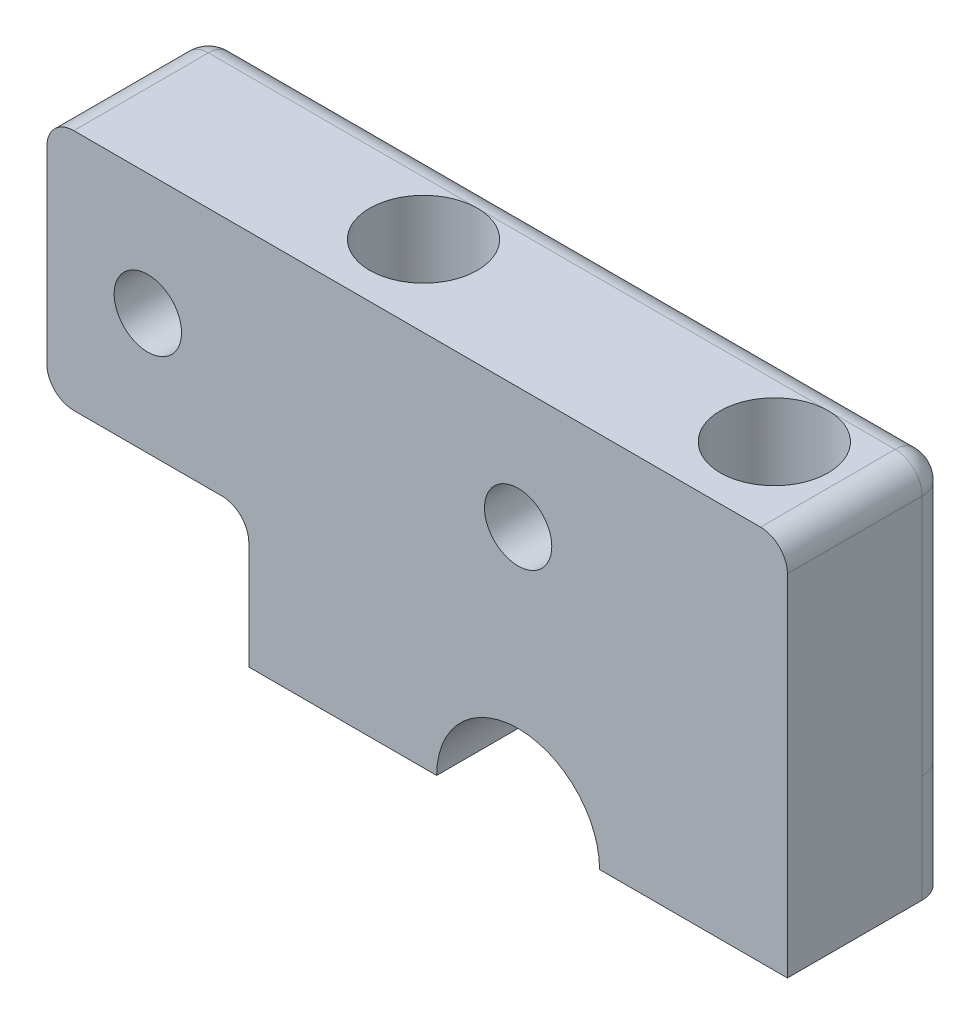
from build123d import *

# Parameters (mm, degrees)
ESQUISSE1_W                  = 40
ESQUISSE1_H                  = 18
BOSS_EXTRU_1_DEPTH           = 12
ESQUISSE2_W                  = 40
ESQUISSE2_H                  = 12
BOSS_EXTRU_2_DEPTH           = 10
ENL_V_MAT_EXTRU_1_DEPTH      = 12
ESQUISSE4_R                  = 2.5
ENL_V_MAT_EXTRU_2_DEPTH      = 28
ESQUISSE5_R                  = 2.5
ENL_V_MAT_EXTRU_3_DEPTH      = 12
ESQUISSE6_R                  = 4
ENL_V_MAT_EXTRU_5_DEPTH      = 12
ESQUISSE7_W                  = 12
ESQUISSE7_H                  = 18
BOSS_EXTRU_3_DEPTH           = 15
ESQUISSE8_W                  = 12
ESQUISSE8_H                  = 18
BOSS_EXTRU_4_DEPTH           = 15
ESQUISSE9_R                  = 2.5
ENL_V_MAT_EXTRU_6_DEPTH      = 12
CONG_1_R                     = 2
ENL_V_MAT_EXTRU_7_DEPTH      = 10
ENL_V_MAT_EXTRU_7_DEPTH_BACK = 27
ESQUISSE11_W                 = 15
ESQUISSE11_H                 = 16.6984892
CONG_2_R                     = 2


# Some blends are built 0.0001 mm under size
with BuildPart() as part:
    # Esquisse1 → Boss.-Extru.1 (new body)
    with BuildSketch(Plane.XY):
        with Locations((3.185612757, 0.725848564)):
            Rectangle(ESQUISSE1_W, ESQUISSE1_H)
    extrude(amount=BOSS_EXTRU_1_DEPTH)

    # Esquisse2 → Boss.-Extru.2 (add)
    with BuildSketch(Plane.XZ.offset(8.274151436)):
        with Locations((3.185612757, 6)):
            Rectangle(ESQUISSE2_W, ESQUISSE2_H)
    extrude(amount=BOSS_EXTRU_2_DEPTH)

    # Esquisse3 → Enlèv. mat.-Extru.1 (cut)
    with BuildSketch(Plane.XY.offset(12)):
        with BuildLine():
            Line((-2.864387243, -18.274151436), (9.235612757, -18.274151436))
            ThreePointArc((9.235612757, -18.274151436), (3.185612757, -12.224151436), (-2.864387243, -18.274151436))
        make_face()
    extrude(amount=-ENL_V_MAT_EXTRU_1_DEPTH, mode=Mode.SUBTRACT)

    # Esquisse4 → Enlèv. mat.-Extru.2 (cut)
    with BuildSketch(Plane.XZ.offset(18.274151436)):
        with Locations(Location((-9.839387243, 6, 0), (0, 0, 270))):
            Circle(ESQUISSE4_R)
        with Locations(Location((16.210612757, 6, 0), (0, 0, 270))):
            Circle(ESQUISSE4_R)
    extrude(amount=-ENL_V_MAT_EXTRU_2_DEPTH, mode=Mode.SUBTRACT)

    # Esquisse5 → Enlèv. mat.-Extru.3 (cut)
    with BuildSketch(Plane.XY.offset(12)):
        with Locations((3.185612757, 0.725848564)):
            Circle(ESQUISSE5_R)
    extrude(amount=-ENL_V_MAT_EXTRU_3_DEPTH, mode=Mode.SUBTRACT)

    # Esquisse6 → Enlèv. mat.-Extru.5 (cut)
    with BuildSketch(Plane(origin=(0, 9.725848564, 0), x_dir=(1, 0, 0), z_dir=(0, 1, 0))):
        with Locations(Location((16.210612757, -6, 0), (0, 0, 270))):
            Circle(ESQUISSE6_R)
        with Locations(Location((-9.839387243, -6, 0), (0, 0, 270))):
            Circle(ESQUISSE6_R)
    extrude(amount=-ENL_V_MAT_EXTRU_5_DEPTH, mode=Mode.SUBTRACT)

    # Esquisse7 → Boss.-Extru.3 (add)
    with BuildSketch(Plane.ZY.offset(16.814387243)):
        with Locations((6, 0.725848564)):
            Rectangle(ESQUISSE7_W, ESQUISSE7_H)
    extrude(amount=BOSS_EXTRU_3_DEPTH)

    # Esquisse8 → Boss.-Extru.4 (add)
    with BuildSketch(Plane(origin=(23.185612757, 0, 0), x_dir=(0, 0, -1), z_dir=(1, 0, 0))):
        with Locations((-6, 0.725848564)):
            Rectangle(ESQUISSE8_W, ESQUISSE8_H)
    extrude(amount=BOSS_EXTRU_4_DEPTH)

    # Esquisse9 → Enlèv. mat.-Extru.6 (cut)
    with BuildSketch(Plane.XY.offset(12)):
        with Locations((-24.314387243, 0.725848564)):
            Circle(ESQUISSE9_R)
        with Locations((30.685612757, 0.725848564)):
            Circle(ESQUISSE9_R)
    extrude(amount=-ENL_V_MAT_EXTRU_6_DEPTH, mode=Mode.SUBTRACT)

    # Congé1
    cong_1_edges = [part.edges().sort_by_distance(p)[0] for p in [
        (3.185612757, 9.725848564, 0),
        (23.185612757, -13.274151436, 0),
        (-16.814387243, -13.274151436, 0),
        (-16.814387243, -8.274151436, 6),
        (-24.314387243, -8.274151436, 0),
        (-31.814387243, 0.725848564, 0),
        (-31.814387243, -8.274151436, 6),
        (-31.814387243, 9.725848564, 6),
        (30.685612757, -8.274151436, 0),
        (23.185612757, -8.274151436, 6),
        (38.185612757, 0.725848564, 0),
        (38.185612757, 9.725848564, 6),
        (38.185612757, -8.274151436, 6),
    ]]
    fillet(cong_1_edges, radius=CONG_1_R - 0.0001)  # a hair under: the kernel refuses the full size

    # Esquisse11 → Enlèv. mat.-Extru.7 (cut, two sides: drawn at the far end of the back side and taken through both)
    with BuildSketch(Plane.XZ.offset(8.274151436).offset(-ENL_V_MAT_EXTRU_7_DEPTH_BACK)):
        with Locations((30.685612757, 5.475380595)):
            Rectangle(ESQUISSE11_W, ESQUISSE11_H)
    extrude(amount=ENL_V_MAT_EXTRU_7_DEPTH + ENL_V_MAT_EXTRU_7_DEPTH_BACK, mode=Mode.SUBTRACT)

    # Congé2
    # the kernel refuses this fillet: 2 mm, written as the material it takes off along each edge
    with BuildSketch(Plane(origin=(23.185612757, 9.725848564, 1.9999), x_dir=(-0.999999998749875, 5.00025000614922e-05, 0), z_dir=(0, 0, 1))) as cong_2_piece_1:
        with BuildLine():
            CenterArc((1.999799997, 1.999999997), CONG_2_R, 180.002864932, 90)
            Line((-0.0002, 1.999899992), (-0.0402, 1.999897992))
            ThreePointArc((-0.0402, 1.999897992), (-0.04005, 0.999947999), (-0.04, -2e-06))
            Line((-0.04, -2e-06), (2e-06, -0.04))
            ThreePointArc((2e-06, -0.04), (0.999951999, -0.03995), (1.999902003, -0.04))
            Line((1.999902003, -0.04), (1.999900003, 0))
        make_face()
    extrude(amount=14.999850006, mode=Mode.SUBTRACT)
    with BuildSketch(Plane(origin=(23.185612757, 7.725948564, 1.9999), x_dir=(0, 1, 0), z_dir=(0, 0, 1))) as cong_2_piece_2:
        with BuildLine():
            CenterArc((0, 1.9999), CONG_2_R, 270, 90)
            Line((2, 1.9999), (2.04, 1.9999))
            ThreePointArc((2.04, 1.9999), (2.0399, 0.99995), (2.0399, 0))
            Line((2.0399, 0), (1.9999, -0.04))
            ThreePointArc((1.9999, -0.04), (0.99995, -0.04), (0, -0.0401))
            Line((0, -0.0401), (0, -0.0001))
        make_face()
    revolve(axis=Axis((23.185612757, 7.725948564, 1.9999), (-1, 0, 0)), revolution_arc=90, mode=Mode.SUBTRACT)
    with BuildSketch(Plane(origin=(23.185612757, -11.809873032, 0), x_dir=(-0.999999998749875, 0, -5.000250006249136e-05), z_dir=(0, 1, 0))) as cong_2_piece_3:
        with BuildLine():
            CenterArc((1.999799998, 1.999999997), CONG_2_R, 180.002864932, 90)
            Line((-0.0002, 1.999899992), (-0.0402, 1.999897992))
            ThreePointArc((-0.0402, 1.999897992), (-0.04005, 0.999947999), (-0.04, -2e-06))
            Line((-0.04, -2e-06), (2e-06, -0.04))
            ThreePointArc((2e-06, -0.04), (0.999951999, -0.03995), (1.999902003, -0.04))
            Line((1.999902003, -0.04), (1.999900003, 0))
        make_face()
    extrude(amount=19.535821596, mode=Mode.SUBTRACT)


solid = part.part
